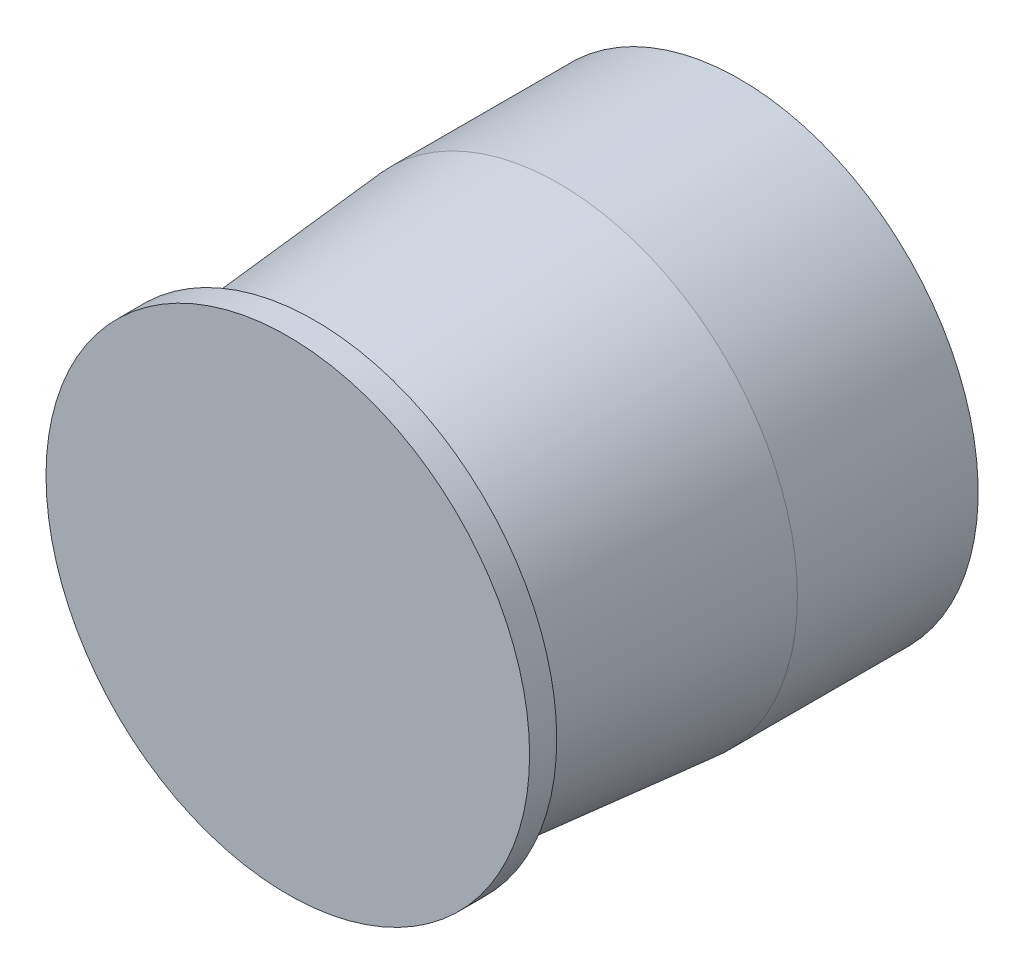
from build123d import *

# Parameters (mm, degrees)
SKETCH1_R           = 23.75
BOSS_EXTRUDE1_DEPTH = 30
BOSS_EXTRUDE1_DRAFT = 5
SKETCH1_3_R         = 26.75
BOSS_EXTRUDE2_DEPTH = 3
SKETCH2_R           = 26.374659906
BOSS_EXTRUDE3_DEPTH = 20


with BuildPart() as part:
    # Sketch1 → Boss-Extrude1 (with draft: the straight prism first)
    with BuildSketch(Plane.XY):
        Circle(SKETCH1_R)
    extrude(amount=-BOSS_EXTRUDE1_DEPTH)
    # Boss-Extrude1: the draft: its side faces are tilted about the plane it starts from
    boss_extrude1_sides = [part.faces().sort_by_distance(p)[0] for p in [
        (-23.75, 0, -15),
    ]]
    draft(boss_extrude1_sides, Plane.XY, BOSS_EXTRUDE1_DRAFT)

    # Sketch1<3> → Boss-Extrude2 (add)
    with BuildSketch(Plane.XY):
        Circle(SKETCH1_3_R)
    extrude(amount=-BOSS_EXTRUDE2_DEPTH)

    # Sketch2 → Boss-Extrude3 (add)
    with BuildSketch(Plane(origin=(0, 0, -30), x_dir=(-1, 0, 0), z_dir=(0, 0, -1))):
        Circle(SKETCH2_R)
    extrude(amount=BOSS_EXTRUDE3_DEPTH)


solid = part.part
